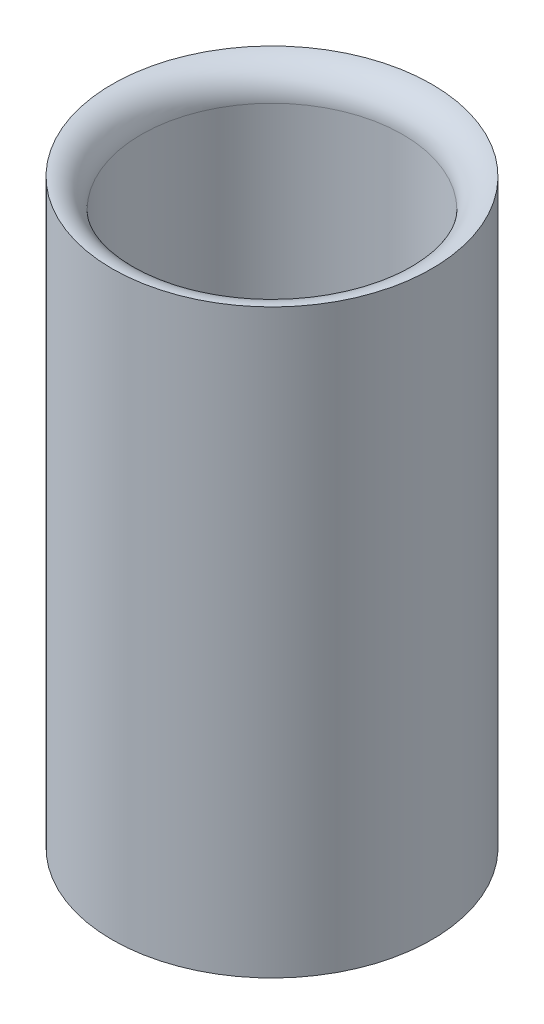
from build123d import *

# Parameters (mm, degrees)
SKETCH_1_W = 10
SKETCH_1_H = 200
FILLET_2_R = 10


with BuildPart() as part:
    # Эскиз1 → Повернуть1 (revolve)
    with BuildSketch(Plane.XY, mode=Mode.PRIVATE) as revolve_1_sk:
        with Locations((50, 0)):
            Rectangle(SKETCH_1_W, SKETCH_1_H)
    revolve(revolve_1_sk.sketch.rotate(Axis((0, -110.603092707, 0), (0, 1, 0)), 90), axis=Axis((0, -110.603092707, 0), (0, 1, 0)))

    # Скругление2
    fillet_2_edges = [part.edges().sort_by_distance(p)[0] for p in [
        (0, 100, 45),
    ]]
    fillet(fillet_2_edges, radius=FILLET_2_R - 0.0001)  # a hair under: the kernel refuses the full size


solid = part.part
